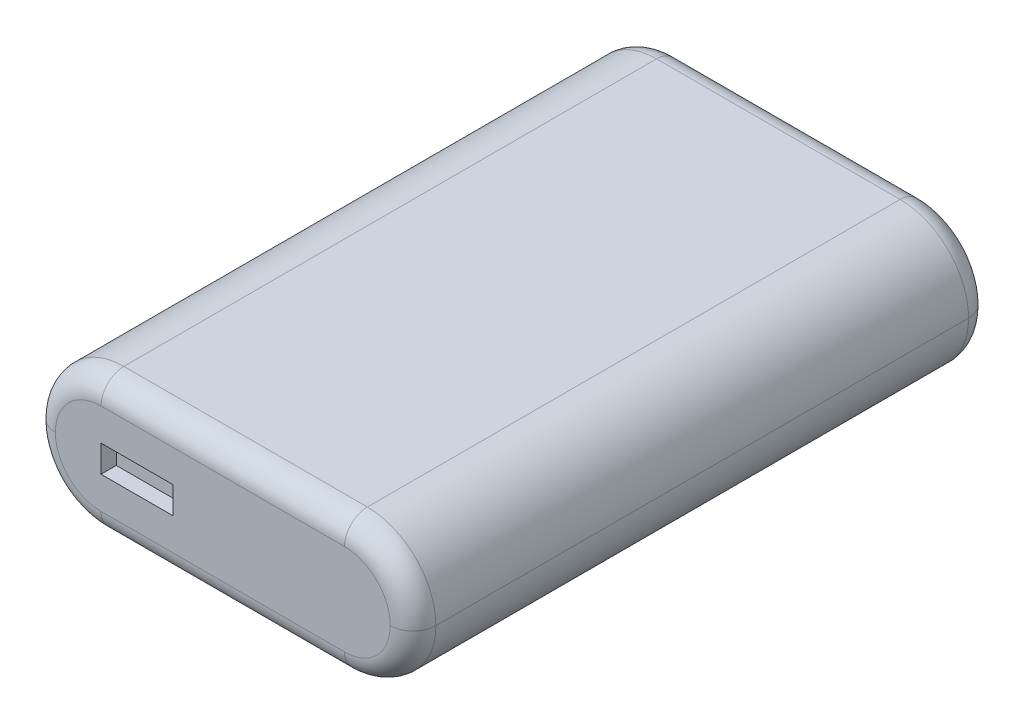
from build123d import *

# Parameters (mm, degrees)
SKETCH1_W           = 63.5
SKETCH1_H           = 96.52
BOSS_EXTRUDE1_DEPTH = 11.43
FILLET1_R           = 11.43
FILLET2_R           = 3.81
SKETCH2_W           = 12
SKETCH2_H           = 4.49999989
CUT_EXTRUDE1_DEPTH  = 2.54


with BuildPart() as part:
    # Sketch1 → Boss-Extrude1 (new, symmetric)
    with BuildSketch(Plane(origin=(0, 0, 0), x_dir=(1, 0, 0), z_dir=(0, 1, 0))):
        Rectangle(SKETCH1_W, SKETCH1_H)
    extrude(amount=BOSS_EXTRUDE1_DEPTH, both=True)

    # Fillet1
    fillet1_edges = [part.edges().sort_by_distance(p)[0] for p in [
        (-31.75, -11.43, 0),
        (-31.75, 11.43, 0),
        (31.75, -11.43, 0),
        (31.75, 11.43, 0),
    ]]
    fillet(fillet1_edges, radius=FILLET1_R - 0.0001)  # a hair under: the kernel refuses the full size

    # Fillet2
    fillet2_edges = [part.edges().sort_by_distance(p)[0] for p in [
        (0, -11.43, 48.26),
        (0, 11.43, 48.26),
        (28.402259798, 8.082259798, 48.26),
        (28.402259798, -8.082259798, 48.26),
        (-28.402259798, 8.082259798, 48.26),
        (-28.402259798, -8.082259798, 48.26),
        (0, -11.43, -48.26),
        (0, 11.43, -48.26),
        (28.402259798, 8.082259798, -48.26),
        (28.402259798, -8.082259798, -48.26),
        (-28.402259798, 8.082259798, -48.26),
        (-28.402259798, -8.082259798, -48.26),
    ]]
    fillet(fillet2_edges, radius=FILLET2_R)

    # Sketch2 → Cut-Extrude1 (cut)
    with BuildSketch(Plane.XY.offset(48.26)):
        with Locations((-14.32, 0)):
            Rectangle(SKETCH2_W, SKETCH2_H)
    extrude(amount=-CUT_EXTRUDE1_DEPTH, mode=Mode.SUBTRACT)


solid = part.part
